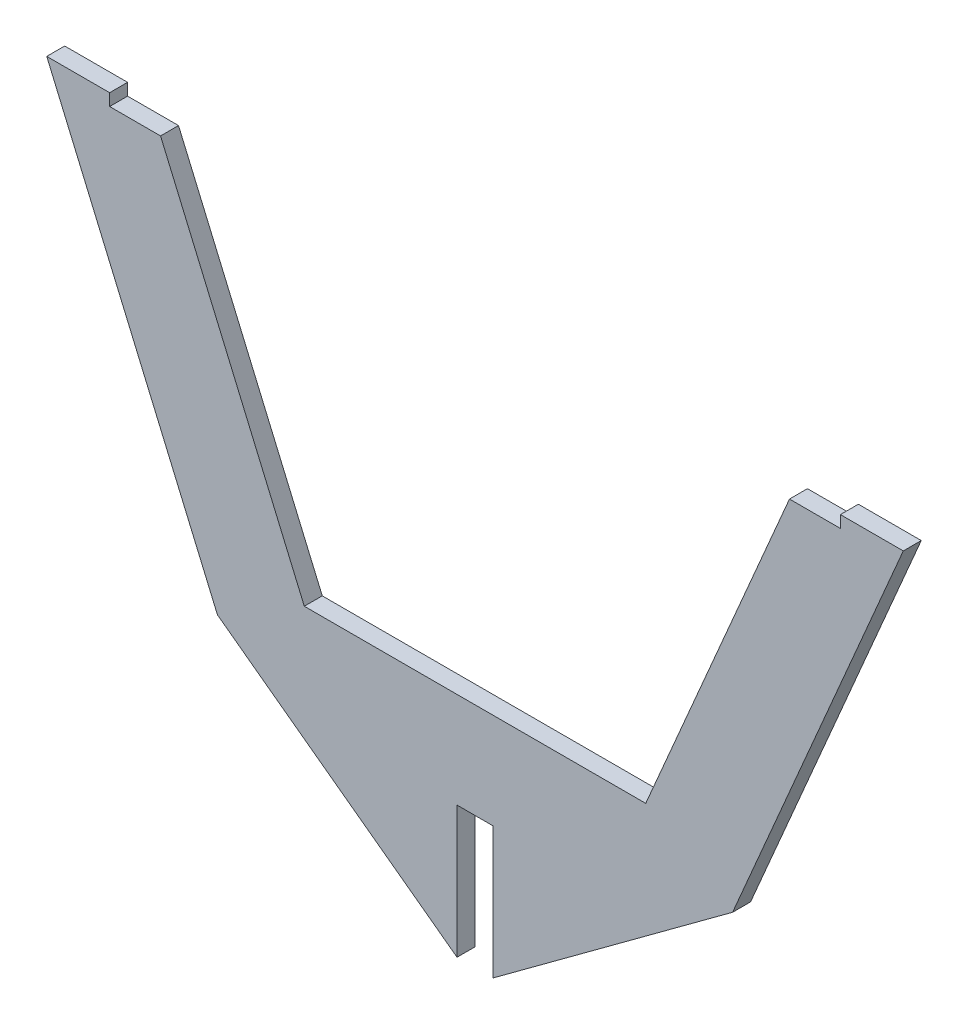
from build123d import *

# Parameters (mm, degrees)
BOSS_EXTRU_3_DEPTH = 3


with BuildPart() as part:
    # Esquisse3 → Boss.-Extru.3 (new body)
    with BuildSketch(Plane.XY):
        Polygon((-10.193525284, 41.575273715), (0.306474716, 41.575273715), (0.306474716, 39.575273715), (8.806474716, 39.575273715), (32.806474716, -16.424726285), (52.249213846, -16.424726285), (70.363735586, -16.424726285), (89.806474716, -16.424726285), (113.806474716, 39.575273715), (122.306474716, 39.575273715), (122.306474716, 41.575273715), (132.806474716, 41.575273715), (104.306474716, -24.924726285), (97.476676754, -29.961702282), (64.306474716, -54.424726285), (64.306474716, -32.424726285), (58.306474716, -32.424726285), (58.306474716, -54.424726285), (25.136272677, -29.961702282), (18.306474716, -24.924726285), align=None)
    extrude(amount=BOSS_EXTRU_3_DEPTH)


solid = part.part
